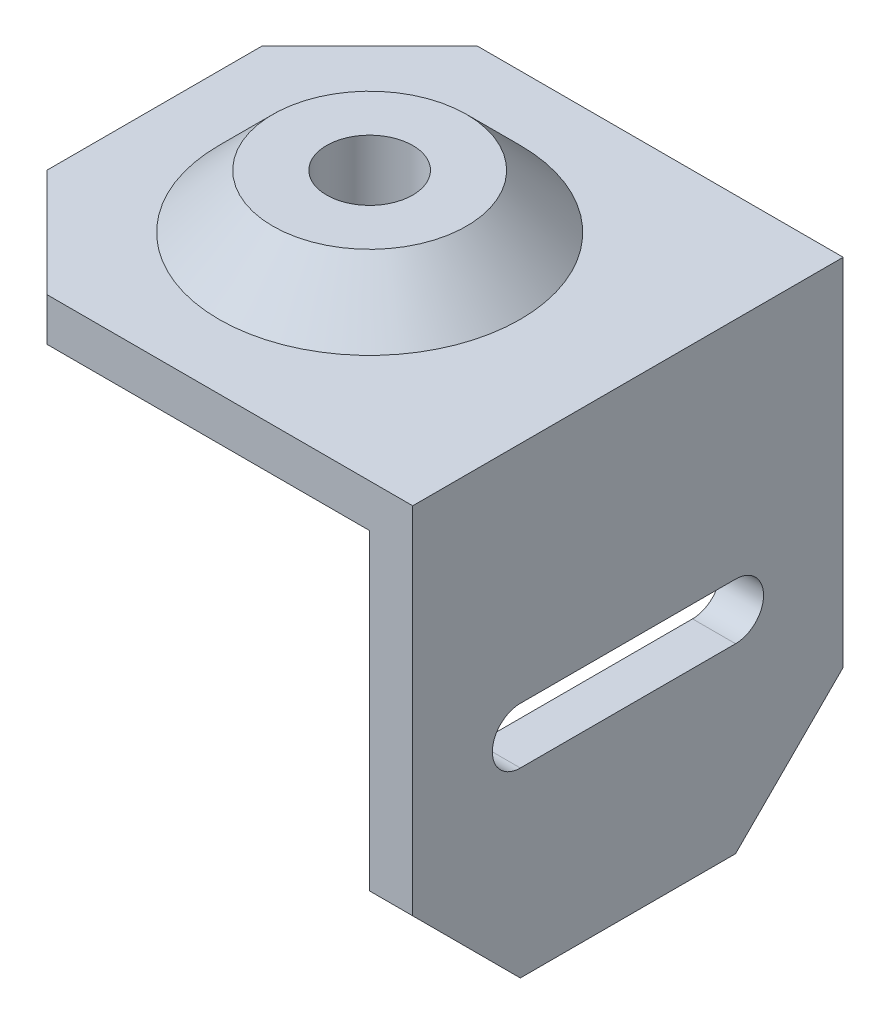
from build123d import *

# Parameters (mm, degrees)
SKETCH1_W               = 40
SKETCH1_H               = 40
SKETCH1_R               = 4
BOSS_EXTRUDE1_DEPTH     = 4
SKETCH2_R               = 9
SKETCH2_R_2             = 4
BOSS_EXTRUDE2_DEPTH     = 5
SKETCH3_W               = 40
SKETCH3_H               = 43
BOSS_EXTRUDE3_DEPTH     = 4
CUT_EXTRUDE1_DEPTH      = 60.338014797
CUT_EXTRUDE1_DEPTH_BACK = 60.338014797
CHAMFER2_SIZE           = 5
CHAMFER3_SIZE           = 10


with BuildPart() as part:
    # Sketch1 → Boss-Extrude1 (new body)
    with BuildSketch(Plane(origin=(0, 0, 0), x_dir=(1, 0, 0), z_dir=(0, 1, 0))):
        Rectangle(SKETCH1_W, SKETCH1_H)
        with Locations(Location((0, 0, 0), (0, 0, 270))):
            Circle(SKETCH1_R, mode=Mode.SUBTRACT)
    extrude(amount=BOSS_EXTRUDE1_DEPTH)

    # Sketch2 → Boss-Extrude2 (add)
    with BuildSketch(Plane(origin=(0, 4, 0), x_dir=(1, 0, 0), z_dir=(0, 1, 0))):
        with Locations(Location((0, 0, 0), (0, 0, 270))):
            Circle(SKETCH2_R)
        with Locations(Location((0, 0, 0), (0, 0, 270))):
            Circle(SKETCH2_R_2, mode=Mode.SUBTRACT)
    extrude(amount=BOSS_EXTRUDE2_DEPTH)

    # Sketch3 → Boss-Extrude3 (add)
    with BuildSketch(Plane(origin=(20, 0, 0), x_dir=(0, 0, -1), z_dir=(1, 0, 0))):
        with Locations((0, -17.5)):
            Rectangle(SKETCH3_W, SKETCH3_H)
    extrude(amount=BOSS_EXTRUDE3_DEPTH)

    # Sketch4 → Cut-Extrude1 (cut, two sides: drawn at the far end of the back side and taken through both)
    with BuildSketch(Plane.ZY.offset(-20).offset(-CUT_EXTRUDE1_DEPTH_BACK)):
        with BuildLine():
            Line((-10, -16.9), (10, -16.9))
            ThreePointArc((10, -16.9), (12.6, -19.5), (10, -22.1))
            Line((10, -22.1), (-10, -22.1))
            ThreePointArc((-10, -22.1), (-12.6, -19.5), (-10, -16.9))
        make_face()
    extrude(amount=CUT_EXTRUDE1_DEPTH + CUT_EXTRUDE1_DEPTH_BACK, mode=Mode.SUBTRACT)

    # Chamfer2
    chamfer2_edges = [part.edges().sort_by_distance(p)[0] for p in [
        (0, 4, -9),
    ]]
    chamfer(chamfer2_edges, length=CHAMFER2_SIZE - 0.0001)  # a hair under: the kernel refuses the full size

    # Chamfer3
    chamfer3_edges = [part.edges().sort_by_distance(p)[0] for p in [
        (22, -39, 20),
        (22, -39, -20),
        (-20, 2, 20),
        (-20, 2, -20),
    ]]
    chamfer(chamfer3_edges, length=CHAMFER3_SIZE)


solid = part.part
